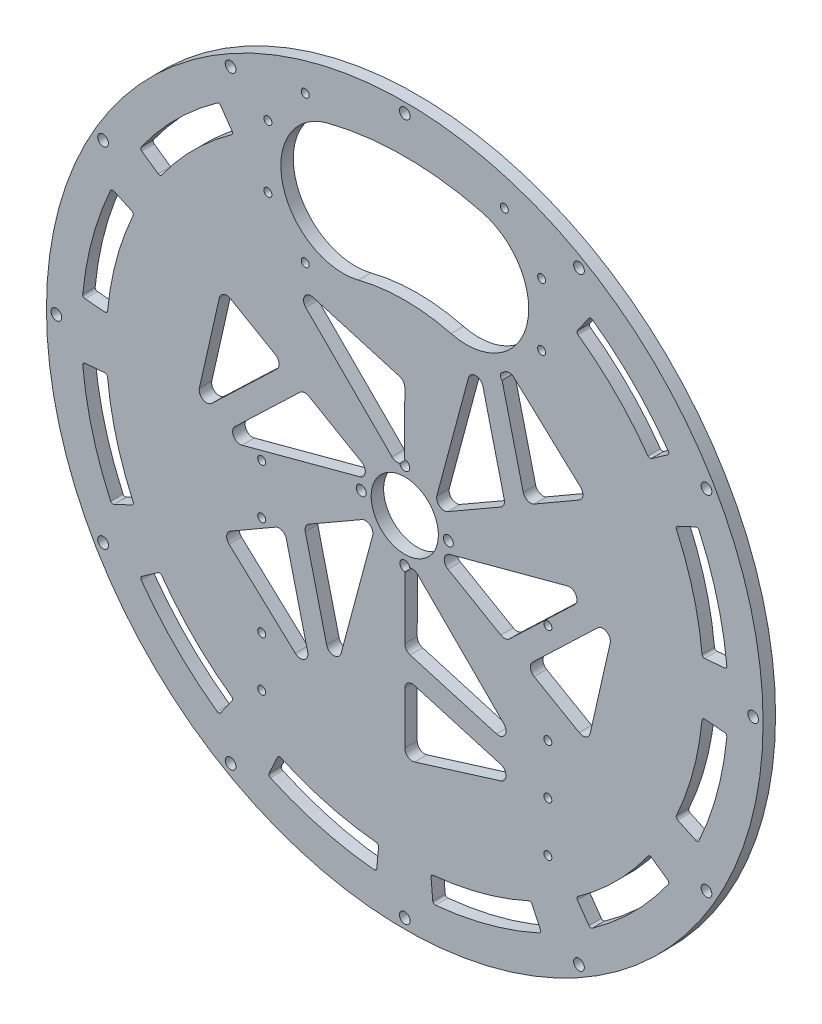
from build123d import *

# Parameters (mm, degrees)
EXTRUDE_1_DEPTH     = 5
SKETCH_2_R          = 1.6
CUT_EXTRUDE_1_DEPTH = 66
SKETCH_3_R          = 2.15
CUT_EXTRUDE_2_DEPTH = 10
CUT_EXTRUDE_3_DEPTH = 10
CUT_EXTRUDE_4_DEPTH = 10
SKETCH_6_R          = 1.6
CUT_EXTRUDE_5_DEPTH = 10


with BuildPart() as part:
    # 草图1 → 凸台-拉伸1 (new body)
    with BuildSketch(Plane.XY):
        with BuildLine():
            ThreePointArc((0, -144), (144, 0), (0, 144))
            ThreePointArc((0, 144), (-144, 0), (0, -144))
        make_face()
        with BuildLine():
            ThreePointArc((0, -19.5), (-2, -17.5), (0, -15.5))
            ThreePointArc((0, -15.5), (2, -17.5), (0, -19.5))
        make_face(mode=Mode.SUBTRACT)
        with BuildLine():
            ThreePointArc((-19.5, 0), (-18.914213562, 1.414213562), (-17.5, 2))
            ThreePointArc((-17.5, 2), (-16.085786438, 1.414213562), (-15.5, 0))
            ThreePointArc((-15.5, 0), (-16.085786438, -1.414213562), (-17.5, -2))
            ThreePointArc((-17.5, -2), (-18.914213562, -1.414213562), (-19.5, 0))
        make_face(mode=Mode.SUBTRACT)
        with BuildLine():
            ThreePointArc((0, 15.5), (-2, 17.5), (0, 19.5))
            ThreePointArc((0, 19.5), (2, 17.5), (0, 15.5))
        make_face(mode=Mode.SUBTRACT)
        with BuildLine():
            ThreePointArc((31.004898177, 121.09375), (49.607837082, 93.75), (24.803918541, 71.875))
            ThreePointArc((24.803918541, 71.875), (21.678918541, 72.071081459), (18.602938906, 72.65625))
            ThreePointArc((18.602938906, 72.65625), (0, 75), (-18.602938906, 72.65625))
            ThreePointArc((-18.602938906, 72.65625), (-21.678918541, 72.071081459), (-24.803918541, 71.875))
            ThreePointArc((-24.803918541, 71.875), (-49.607837082, 93.75), (-31.004898177, 121.09375))
            ThreePointArc((-31.004898177, 121.09375), (0, 125), (31.004898177, 121.09375))
        make_face(mode=Mode.SUBTRACT)
        with BuildLine():
            ThreePointArc((0, -13.5), (-13.5, 0), (0, 13.5))
            ThreePointArc((0, 13.5), (13.5, 0), (0, -13.5))
        make_face(mode=Mode.SUBTRACT)
        with BuildLine():
            ThreePointArc((17.5, -2), (15.5, 0), (17.5, 2))
            ThreePointArc((17.5, 2), (19.5, 0), (17.5, -2))
        make_face(mode=Mode.SUBTRACT)
    extrude(amount=EXTRUDE_1_DEPTH)

    # 草图2 → 切除-拉伸1 (cut)
    with BuildSketch(Plane.XY.offset(5)):
        with Locations((-57.5, -9.534819638)):
            Circle(SKETCH_2_R)
        with Locations((-57.5, -29.534819638)):
            Circle(SKETCH_2_R)
        with Locations((-57.5, -49.534819638)):
            Circle(SKETCH_2_R)
        with Locations((-57.5, -69.534819638)):
            Circle(SKETCH_2_R)
        with Locations((-57.5, -89.534819638)):
            Circle(SKETCH_2_R)
        with Locations((57.5, -89.534819638)):
            Circle(SKETCH_2_R)
        with Locations((57.5, -69.534819638)):
            Circle(SKETCH_2_R)
        with Locations((57.5, -49.534819638)):
            Circle(SKETCH_2_R)
        with Locations((57.5, -29.534819638)):
            Circle(SKETCH_2_R)
        with Locations((57.5, -9.534819638)):
            Circle(SKETCH_2_R)
    extrude(amount=-CUT_EXTRUDE_1_DEPTH, mode=Mode.SUBTRACT)

    # 草图3 → 切除-拉伸2 (cut)
    with BuildSketch(Plane.XY.offset(5)):
        with Locations((0, 140)):
            Circle(SKETCH_3_R)
        with Locations((70, 121.24355653)):
            Circle(SKETCH_3_R)
        with Locations((121.24355653, 70)):
            Circle(SKETCH_3_R)
        with Locations((140, 0)):
            Circle(SKETCH_3_R)
        with Locations((121.24355653, -70)):
            Circle(SKETCH_3_R)
        with Locations((70, -121.24355653)):
            Circle(SKETCH_3_R)
        with Locations((0, -140)):
            Circle(SKETCH_3_R)
        with Locations((-70, -121.24355653)):
            Circle(SKETCH_3_R)
        with Locations((-121.24355653, -70)):
            Circle(SKETCH_3_R)
        with Locations((-140, 0)):
            Circle(SKETCH_3_R)
        with Locations((-121.24355653, 70)):
            Circle(SKETCH_3_R)
        with Locations((-70, 121.24355653)):
            Circle(SKETCH_3_R)
    extrude(amount=-CUT_EXTRUDE_2_DEPTH, mode=Mode.SUBTRACT)

    # 草图4 → 切除-拉伸3 (cut)
    with BuildSketch(Plane.XY.offset(5)):
        with BuildLine():
            Line((-73.989137091, 105.667438658), (-69.400378607, 99.114012375))
            ThreePointArc((-69.400378607, 99.114012375), (-69.234013746, 98.370858732), (-69.639203952, 97.726052171))
            ThreePointArc((-69.639203952, 97.726052171), (-84.852813742, 84.852813742), (-97.726052171, 69.639203952))
            ThreePointArc((-97.726052171, 69.639203952), (-98.370858732, 69.234013746), (-99.114012375, 69.400378607))
            Line((-99.114012375, 69.400378607), (-105.667438658, 73.989137091))
            ThreePointArc((-105.667438658, 73.989137091), (-106.079335637, 74.638459375), (-105.908543324, 75.388198354))
            ThreePointArc((-105.908543324, 75.388198354), (-91.923881554, 91.923881554), (-75.388198354, 105.908543324))
            ThreePointArc((-75.388198354, 105.908543324), (-74.638459375, 106.079335637), (-73.989137091, 105.667438658))
        make_face()
        with BuildLine():
            Line((105.667438658, 73.989137091), (99.114012375, 69.400378607))
            ThreePointArc((99.114012375, 69.400378607), (98.370858732, 69.234013746), (97.726052171, 69.639203952))
            ThreePointArc((97.726052171, 69.639203952), (84.852813742, 84.852813742), (69.639203952, 97.726052171))
            ThreePointArc((69.639203952, 97.726052171), (69.234013746, 98.370858732), (69.400378607, 99.114012375))
            Line((69.400378607, 99.114012375), (73.989137091, 105.667438658))
            ThreePointArc((73.989137091, 105.667438658), (74.638459375, 106.079335637), (75.388198354, 105.908543324))
            ThreePointArc((75.388198354, 105.908543324), (91.923881554, 91.923881554), (105.908543324, 75.388198354))
            ThreePointArc((105.908543324, 75.388198354), (106.079335637, 74.638459375), (105.667438658, 73.989137091))
        make_face()
        with BuildLine():
            Line((128.505254776, 11.242752996), (120.535441892, 10.545484719))
            ThreePointArc((120.535441892, 10.545484719), (119.808669527, 10.772985344), (119.452845768, 11.446293636))
            ThreePointArc((119.452845768, 11.446293636), (115.911099155, 31.058285412), (109.172345807, 49.813641816))
            ThreePointArc((109.172345807, 49.813641816), (109.143844076, 50.574655781), (109.659497094, 51.135063284))
            Line((109.659497094, 51.135063284), (116.910191654, 54.516117685))
            ThreePointArc((116.910191654, 54.516117685), (117.678469737, 54.54816979), (118.242366582, 54.025389819))
            ThreePointArc((118.242366582, 54.025389819), (125.570357418, 33.646475863), (129.413588173, 12.333823258))
            ThreePointArc((129.413588173, 12.333823258), (129.186629166, 11.5991341), (128.505254776, 11.242752996))
        make_face()
        with BuildLine():
            Line((116.910191654, -54.516117685), (109.659497094, -51.135063284))
            ThreePointArc((109.659497094, -51.135063284), (109.143844076, -50.574655781), (109.172345807, -49.813641816))
            ThreePointArc((109.172345807, -49.813641816), (115.911099155, -31.058285412), (119.452845768, -11.446293636))
            ThreePointArc((119.452845768, -11.446293636), (119.808669527, -10.772985344), (120.535441892, -10.545484719))
            Line((120.535441892, -10.545484719), (128.505254776, -11.242752996))
            ThreePointArc((128.505254776, -11.242752996), (129.186629166, -11.5991341), (129.413588173, -12.333823258))
            ThreePointArc((129.413588173, -12.333823258), (125.570357418, -33.646475863), (118.242366582, -54.025389819))
            ThreePointArc((118.242366582, -54.025389819), (117.678469737, -54.54816979), (116.910191654, -54.516117685))
        make_face()
        with BuildLine():
            Line((73.989137091, -105.667438658), (69.400378607, -99.114012375))
            ThreePointArc((69.400378607, -99.114012375), (69.234013746, -98.370858732), (69.639203952, -97.726052171))
            ThreePointArc((69.639203952, -97.726052171), (84.852813742, -84.852813742), (97.726052171, -69.639203952))
            ThreePointArc((97.726052171, -69.639203952), (98.370858732, -69.234013746), (99.114012375, -69.400378607))
            Line((99.114012375, -69.400378607), (105.667438658, -73.989137091))
            ThreePointArc((105.667438658, -73.989137091), (106.079335637, -74.638459375), (105.908543324, -75.388198354))
            ThreePointArc((105.908543324, -75.388198354), (91.923881554, -91.923881554), (75.388198354, -105.908543324))
            ThreePointArc((75.388198354, -105.908543324), (74.638459375, -106.079335637), (73.989137091, -105.667438658))
        make_face()
        with BuildLine():
            Line((11.242752996, -128.505254776), (10.545484719, -120.535441892))
            ThreePointArc((10.545484719, -120.535441892), (10.772985344, -119.808669527), (11.446293636, -119.452845768))
            ThreePointArc((11.446293636, -119.452845768), (31.058285412, -115.911099155), (49.813641816, -109.172345807))
            ThreePointArc((49.813641816, -109.172345807), (50.574655781, -109.143844076), (51.135063284, -109.659497094))
            Line((51.135063284, -109.659497094), (54.516117685, -116.910191654))
            ThreePointArc((54.516117685, -116.910191654), (54.54816979, -117.678469737), (54.025389819, -118.242366582))
            ThreePointArc((54.025389819, -118.242366582), (33.646475863, -125.570357418), (12.333823258, -129.413588173))
            ThreePointArc((12.333823258, -129.413588173), (11.5991341, -129.186629166), (11.242752996, -128.505254776))
        make_face()
        with BuildLine():
            Line((-54.516117685, -116.910191654), (-51.135063284, -109.659497094))
            ThreePointArc((-51.135063284, -109.659497094), (-50.574655781, -109.143844076), (-49.813641816, -109.172345807))
            ThreePointArc((-49.813641816, -109.172345807), (-31.058285412, -115.911099155), (-11.446293636, -119.452845768))
            ThreePointArc((-11.446293636, -119.452845768), (-10.772985344, -119.808669527), (-10.545484719, -120.535441892))
            Line((-10.545484719, -120.535441892), (-11.242752996, -128.505254776))
            ThreePointArc((-11.242752996, -128.505254776), (-11.5991341, -129.186629166), (-12.333823258, -129.413588173))
            ThreePointArc((-12.333823258, -129.413588173), (-33.646475863, -125.570357418), (-54.025389819, -118.242366582))
            ThreePointArc((-54.025389819, -118.242366582), (-54.54816979, -117.678469737), (-54.516117685, -116.910191654))
        make_face()
        with BuildLine():
            Line((-105.667438658, -73.989137091), (-99.114012375, -69.400378607))
            ThreePointArc((-99.114012375, -69.400378607), (-98.370858732, -69.234013746), (-97.726052171, -69.639203952))
            ThreePointArc((-97.726052171, -69.639203952), (-84.852813742, -84.852813742), (-69.639203952, -97.726052171))
            ThreePointArc((-69.639203952, -97.726052171), (-69.234013746, -98.370858732), (-69.400378607, -99.114012375))
            Line((-69.400378607, -99.114012375), (-73.989137091, -105.667438658))
            ThreePointArc((-73.989137091, -105.667438658), (-74.638459375, -106.079335637), (-75.388198354, -105.908543324))
            ThreePointArc((-75.388198354, -105.908543324), (-91.923881554, -91.923881554), (-105.908543324, -75.388198354))
            ThreePointArc((-105.908543324, -75.388198354), (-106.079335637, -74.638459375), (-105.667438658, -73.989137091))
        make_face()
        with BuildLine():
            Line((-128.505254776, -11.242752996), (-120.535441892, -10.545484719))
            ThreePointArc((-120.535441892, -10.545484719), (-119.808669527, -10.772985344), (-119.452845768, -11.446293636))
            ThreePointArc((-119.452845768, -11.446293636), (-115.911099155, -31.058285412), (-109.172345807, -49.813641816))
            ThreePointArc((-109.172345807, -49.813641816), (-109.143844076, -50.574655781), (-109.659497094, -51.135063284))
            Line((-109.659497094, -51.135063284), (-116.910191654, -54.516117685))
            ThreePointArc((-116.910191654, -54.516117685), (-117.678469737, -54.54816979), (-118.242366582, -54.025389819))
            ThreePointArc((-118.242366582, -54.025389819), (-125.570357418, -33.646475863), (-129.413588173, -12.333823258))
            ThreePointArc((-129.413588173, -12.333823258), (-129.186629166, -11.5991341), (-128.505254776, -11.242752996))
        make_face()
        with BuildLine():
            Line((-116.910191654, 54.516117685), (-109.659497094, 51.135063284))
            ThreePointArc((-109.659497094, 51.135063284), (-109.143844076, 50.574655781), (-109.172345807, 49.813641816))
            ThreePointArc((-109.172345807, 49.813641816), (-115.911099155, 31.058285412), (-119.452845768, 11.446293636))
            ThreePointArc((-119.452845768, 11.446293636), (-119.808669527, 10.772985344), (-120.535441892, 10.545484719))
            Line((-120.535441892, 10.545484719), (-128.505254776, 11.242752996))
            ThreePointArc((-128.505254776, 11.242752996), (-129.186629166, 11.5991341), (-129.413588173, 12.333823258))
            ThreePointArc((-129.413588173, 12.333823258), (-125.570357418, 33.646475863), (-118.242366582, 54.025389819))
            ThreePointArc((-118.242366582, 54.025389819), (-117.678469737, 54.54816979), (-116.910191654, 54.516117685))
        make_face()
    extrude(amount=-CUT_EXTRUDE_3_DEPTH, mode=Mode.SUBTRACT)

    # 草图5 → 切除-拉伸4 (cut)
    with BuildSketch(Plane(origin=(0, 0, 0), x_dir=(-1, 0, 0), z_dir=(0, 0, -1))):
        with BuildLine():
            Line((2.163160089, 47.416306868), (36.850020902, 57.541000492))
            ThreePointArc((36.850020902, 57.541000492), (40.27187667, 56.189916703), (39.81192982, 52.539851882))
            Line((39.81192982, 52.539851882), (5.165906543, 17.893828605))
            ThreePointArc((5.165906543, 17.893828605), (1.898844226, 17.242555338), (0.04459036, 20.01015279))
            Line((0.04459036, 20.01015279), (0.003752824, 44.531482443))
            ThreePointArc((0.003752824, 44.531482443), (0.60206693, 46.334234104), (2.163160089, 47.416306868))
        make_face()
        with BuildLine():
            Line((51.428278561, 25.257400776), (77.539950852, 0.280044947))
            ThreePointArc((77.539950852, 0.280044947), (81.091887649, -0.162595856), (82.539456158, 3.111046046))
            Line((82.539456158, 3.111046046), (74.512080288, 38.529375281))
            ThreePointArc((74.512080288, 38.529375281), (72.788050834, 40.615033502), (70.086285131, 40.464335587))
            Line((70.086285131, 40.464335587), (52.001988712, 30.023362181))
            ThreePointArc((52.001988712, 30.023362181), (50.523491089, 27.783827337), (51.428278561, 25.257400776))
        make_face()
        with BuildLine():
            Line((42.145306346, 21.834801844), (68.256978636, -3.142553985))
            ThreePointArc((68.256978636, -3.142553985), (68.797833636, -6.781509903), (65.406811351, -8.208216657))
            Line((65.406811351, -8.208216657), (18.079463414, 4.473108002))
            ThreePointArc((18.079463414, 4.473108002), (15.881913062, 6.976830332), (17.35159583, 9.966460011))
            Line((17.35159583, 9.966460011), (38.567271476, 22.26249118))
            ThreePointArc((38.567271476, 22.26249118), (40.427657264, 22.645711796), (42.145306346, 21.834801844))
        make_face()
        with BuildLine():
            Line((47.587689987, -31.909495319), (39.012501464, -67.011544772))
            ThreePointArc((39.012501464, -67.011544772), (40.405131682, -70.308932673), (43.963972987, -69.925742825))
            Line((43.963972987, -69.925742825), (70.623457929, -45.264666778))
            ThreePointArc((70.623457929, -45.264666778), (71.567676205, -42.728784363), (70.086285131, -40.464335587))
            Line((70.086285131, -40.464335587), (52.001988712, -30.023362181))
            ThreePointArc((52.001988712, -30.023362181), (49.323245833, -29.862713102), (47.587689987, -31.909495319))
        make_face()
        with BuildLine():
            Line((39.982146257, -25.581505024), (31.406957734, -60.683554477))
            ThreePointArc((31.406957734, -60.683554477), (28.525956966, -62.971426605), (25.59488153, -60.748068539))
            Line((25.59488153, -60.748068539), (12.913556871, -13.420720603))
            ThreePointArc((12.913556871, -13.420720603), (13.983068836, -10.265725006), (17.30700547, -10.04369278))
            Line((17.30700547, -10.04369278), (38.563518652, -22.268991263))
            ThreePointArc((38.563518652, -22.268991263), (39.825590334, -23.688522308), (39.982146257, -25.581505024))
        make_face()
        with BuildLine():
            Line((-3.840588575, -57.166896095), (-38.527449387, -67.291589719))
            ThreePointArc((-38.527449387, -67.291589719), (-40.686755967, -70.146336816), (-38.575483171, -73.03678887))
            Line((-38.575483171, -73.03678887), (-3.888622359, -83.794042058))
            ThreePointArc((-3.888622359, -83.794042058), (-1.220374629, -83.343817865), (0, -80.928671174))
            Line((0, -80.928671174), (0, -60.046724362))
            ThreePointArc((0, -60.046724362), (-1.200245256, -57.64654044), (-3.840588575, -57.166896095))
        make_face()
        with BuildLine():
            Line((-2.163160089, -47.416306868), (-36.850020902, -57.541000492))
            ThreePointArc((-36.850020902, -57.541000492), (-40.27187667, -56.189916703), (-39.81192982, -52.539851882))
            Line((-39.81192982, -52.539851882), (-5.165906543, -17.893828605))
            ThreePointArc((-5.165906543, -17.893828605), (-1.898844226, -17.242555338), (-0.04459036, -20.01015279))
            Line((-0.04459036, -20.01015279), (-0.003752824, -44.531482443))
            ThreePointArc((-0.003752824, -44.531482443), (-0.60206693, -46.334234104), (-2.163160089, -47.416306868))
        make_face()
        with BuildLine():
            Line((-51.428278561, -25.257400776), (-77.539950852, -0.280044947))
            ThreePointArc((-77.539950852, -0.280044947), (-81.091887649, 0.162595856), (-82.539456158, -3.111046046))
            Line((-82.539456158, -3.111046046), (-74.512080288, -38.529375281))
            ThreePointArc((-74.512080288, -38.529375281), (-72.788050834, -40.615033502), (-70.086285131, -40.464335587))
            Line((-70.086285131, -40.464335587), (-52.001988712, -30.023362181))
            ThreePointArc((-52.001988712, -30.023362181), (-50.523491089, -27.783827337), (-51.428278561, -25.257400776))
        make_face()
        with BuildLine():
            Line((-42.145306346, -21.834801844), (-68.256978636, 3.142553985))
            ThreePointArc((-68.256978636, 3.142553985), (-68.797833636, 6.781509903), (-65.406811351, 8.208216657))
            Line((-65.406811351, 8.208216657), (-18.079463414, -4.473108002))
            ThreePointArc((-18.079463414, -4.473108002), (-15.881913062, -6.976830332), (-17.35159583, -9.966460011))
            Line((-17.35159583, -9.966460011), (-38.567271476, -22.26249118))
            ThreePointArc((-38.567271476, -22.26249118), (-40.427657264, -22.645711796), (-42.145306346, -21.834801844))
        make_face()
        with BuildLine():
            Line((-47.587689987, 31.909495319), (-39.012501464, 67.011544772))
            ThreePointArc((-39.012501464, 67.011544772), (-40.405131682, 70.308932673), (-43.963972987, 69.925742825))
            Line((-43.963972987, 69.925742825), (-70.623457929, 45.264666778))
            ThreePointArc((-70.623457929, 45.264666778), (-71.567676205, 42.728784363), (-70.086285131, 40.464335587))
            Line((-70.086285131, 40.464335587), (-52.001988712, 30.023362181))
            ThreePointArc((-52.001988712, 30.023362181), (-49.323245833, 29.862713102), (-47.587689987, 31.909495319))
        make_face()
        with BuildLine():
            Line((-39.982146257, 25.581505024), (-31.406957734, 60.683554477))
            ThreePointArc((-31.406957734, 60.683554477), (-28.525956966, 62.971426605), (-25.59488153, 60.748068539))
            Line((-25.59488153, 60.748068539), (-12.913556871, 13.420720603))
            ThreePointArc((-12.913556871, 13.420720603), (-13.983068836, 10.265725006), (-17.30700547, 10.04369278))
            Line((-17.30700547, 10.04369278), (-38.563518652, 22.268991263))
            ThreePointArc((-38.563518652, 22.268991263), (-39.825590334, 23.688522308), (-39.982146257, 25.581505024))
        make_face()
    extrude(amount=-CUT_EXTRUDE_4_DEPTH, mode=Mode.SUBTRACT)

    # 草图6 → 切除-拉伸5 (cut)
    with BuildSketch(Plane(origin=(0, 0, 0), x_dir=(-1, 0, 0), z_dir=(0, 0, -1))):
        with Locations((-40, 127)):
            Circle(SKETCH_6_R)
        with Locations((-55, 110)):
            Circle(SKETCH_6_R)
        with Locations((-55, 85)):
            Circle(SKETCH_6_R)
        with Locations((-40, 68)):
            Circle(SKETCH_6_R)
        with Locations((40, 68)):
            Circle(SKETCH_6_R)
        with Locations((55, 85)):
            Circle(SKETCH_6_R)
        with Locations((55, 110)):
            Circle(SKETCH_6_R)
        with Locations((40, 127)):
            Circle(SKETCH_6_R)
    extrude(amount=-CUT_EXTRUDE_5_DEPTH, mode=Mode.SUBTRACT)


solid = part.part
